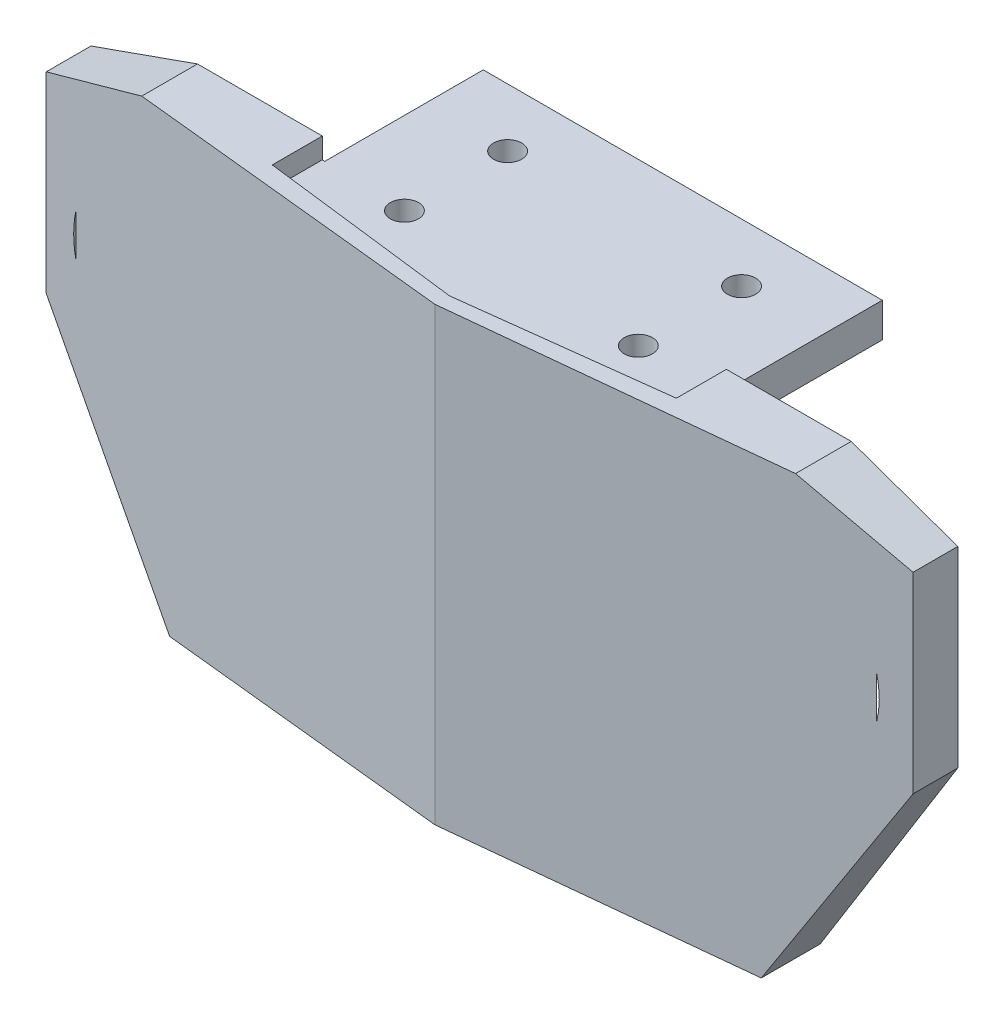
from build123d import *

# Parameters (mm, degrees)
SKETCH1_W                = 200
SKETCH1_H                = 60
BOSS_EXTRUDE1_DEPTH      = 25
SKETCH3_R                = 13.55
CUT_EXTRUDE1_DEPTH       = 7
CUT_EXTRUDE3_DEPTH       = 108.354552768
CUT_EXTRUDE7_DEPTH       = 45
FILLET8_R                = 5
SKETCH13_W               = 227.671202294
SKETCH13_H               = 68.392794906
SKETCH13_W_2             = 126
SKETCH13_H_2             = 41.42
CUT_EXTRUDE8_DEPTH       = 108.354552768
SKETCH14_W               = 12
SKETCH14_H               = 41.42
CUT_EXTRUDE9_DEPTH       = 131.573720174
CUT_EXTRUDE10_DEPTH      = 77.508930198
SKETCH19_W               = 126
SKETCH19_H               = 24.105748896
BOSS_EXTRUDE2_DEPTH      = 13
CUT_EXTRUDE11_DEPTH      = 77.508930198
CUT_EXTRUDE12_DEPTH      = 13
SKETCH22_W               = 58
SKETCH22_H               = 23.025801555
BOSS_EXTRUDE3_DEPTH      = 8
SKETCH24_W               = 40
SKETCH24_H               = 49.525748896
CUT_EXTRUDE13_DEPTH      = 4
CUT_EXTRUDE14_DEPTH      = 94.769991499
CUT_EXTRUDE14_DEPTH_BACK = 3
CUT_EXTRUDE15_DEPTH      = 94.769991499
CUT_EXTRUDE15_DEPTH_BACK = 3
SKETCH27_R               = 2.05
CUT_EXTRUDE16_DEPTH      = 92.69872852


with BuildPart() as part:
    # Sketch1 → Boss-Extrude1 (new body)
    with BuildSketch(Plane.XY):
        Rectangle(SKETCH1_W, SKETCH1_H)
    extrude(amount=BOSS_EXTRUDE1_DEPTH)

    # Sketch3 → Cut-Extrude1 (cut)
    with BuildSketch(Plane(origin=(0, 0, 0), x_dir=(-1, 0, 0), z_dir=(0, 0, -1))):
        with Locations((-45, 0)):
            Circle(SKETCH3_R)
        with Locations((45, 0)):
            Circle(SKETCH3_R)
    extrude(amount=-CUT_EXTRUDE1_DEPTH, mode=Mode.SUBTRACT)

    # Sketch6 → Cut-Extrude3 (cut, through all)
    with BuildSketch(Plane(origin=(0, 0, 0), x_dir=(-1, 0, 0), z_dir=(0, 0, -1))):
        Polygon((-87.020750536, 30), (-100, 15.531551678), (-100, 30), align=None)
        Polygon((-100, -15.090940283), (-89.003501814, -30), (-100, -30), align=None)
        Polygon((100, -15.090940283), (89.003501814, -30), (100, -30), align=None)
        Polygon((87.020750536, 30), (100, 15.531551678), (100, 30), align=None)
    extrude(amount=-CUT_EXTRUDE3_DEPTH, mode=Mode.SUBTRACT)

    # Sketch11 → Cut-Extrude7 (cut)
    with BuildSketch(Plane(origin=(0, 0, 0), x_dir=(-1, 0, 0), z_dir=(0, 0, -1))):
        Polygon((8.001444911, 30), (-99.028209758, 30), (-99.028209758, 24.58), (8.001444911, 24.58), (98.384596387, 24.58), (98.384596387, 30), align=None)
    extrude(amount=-CUT_EXTRUDE7_DEPTH, mode=Mode.SUBTRACT)

    # Fillet8
    fillet8_edges = [part.edges().sort_by_distance(p)[0] for p in [
        (100, 0.220305698, 25),
        (94.501750907, -22.545470141, 25),
        (0, -30, 25),
        (-94.501750907, -22.545470141, 25),
        (-100, 0.220305698, 25),
        (95.941442184, 20.055775839, 25),
        (-95.941442184, 20.055775839, 25),
        (0, 24.58, 25),
    ]]
    fillet(fillet8_edges, radius=FILLET8_R)

    # Sketch13 → Cut-Extrude8 (cut, through all)
    with BuildSketch(Plane(origin=(0, 0, 0), x_dir=(-1, 0, 0), z_dir=(0, 0, -1))):
        with Locations((1.665204381, -2.689234518)):
            Rectangle(SKETCH13_W, SKETCH13_H)
        with Locations((0, 2.71)):
            Rectangle(SKETCH13_W_2, SKETCH13_H_2, mode=Mode.SUBTRACT)
    extrude(amount=-CUT_EXTRUDE8_DEPTH, mode=Mode.SUBTRACT)

    # Sketch14 → Cut-Extrude9 (cut, through all)
    with BuildSketch(Plane(origin=(63, 0, 0), x_dir=(0, 0, -1), z_dir=(1, 0, 0))):
        with Locations((-19, 2.71)):
            Rectangle(SKETCH14_W, SKETCH14_H)
    extrude(amount=-CUT_EXTRUDE9_DEPTH, mode=Mode.SUBTRACT)

    # Sketch15 → Cut-Extrude10 (cut, through all)
    with BuildSketch(Plane(origin=(0, 23.42, 0), x_dir=(1, 0, 0), z_dir=(0, 1, 0))):
        Polygon((63, -6.5), (0, -13), (63, -13), align=None)
        Polygon((0, -13), (-63, -6.5), (-63, -13), align=None)
    extrude(amount=-CUT_EXTRUDE10_DEPTH, mode=Mode.SUBTRACT)

    # Sketch19 → Boss-Extrude2 (add)
    with BuildSketch(Plane(origin=(0, 0, 0), x_dir=(-1, 0, 0), z_dir=(0, 0, -1))):
        with Locations((0, -30.052874448)):
            Rectangle(SKETCH19_W, SKETCH19_H)
    extrude(amount=-BOSS_EXTRUDE2_DEPTH)

    # Sketch20 → Cut-Extrude11 (cut, through all)
    with BuildSketch(Plane(origin=(0, -18, 0), x_dir=(1, 0, 0), z_dir=(0, 1, 0))):
        Polygon((0, -13), (-63, -6.5), (-63, -13), align=None)
        Polygon((63, -6.5), (0, -13), (63, -13), align=None)
    extrude(amount=-CUT_EXTRUDE11_DEPTH, mode=Mode.SUBTRACT)

    # Sketch21 → Cut-Extrude12 (cut)
    with BuildSketch(Plane(origin=(0, 0, 0), x_dir=(-1, 0, 0), z_dir=(0, 0, -1))):
        Polygon((-63, -9.957970409), (-43, -42.105748896), (-63, -42.105748896), align=None)
        Polygon((-47.515984788, 23.42), (-63, 17.935984788), (-63, 23.42), align=None)
    cut_extrude12 = extrude(amount=-CUT_EXTRUDE12_DEPTH, mode=Mode.SUBTRACT)

    # Mirror1: Cut-Extrude12 across plane
    add(cut_extrude12.mirror(Plane(origin=(0, 0, 0), x_dir=(0, 0, 1), z_dir=(1, 0, 0))), mode=Mode.SUBTRACT)

    # Sketch22 → Boss-Extrude3 (add)
    with BuildSketch(Plane(origin=(0, 23.42, 0), x_dir=(1, 0, 0), z_dir=(0, 1, 0))):
        with Locations((0, 11.512900778)):
            Rectangle(SKETCH22_W, SKETCH22_H)
    boss_extrude3 = extrude(amount=-BOSS_EXTRUDE3_DEPTH)

    # Mirror2: Boss-Extrude3 across plane
    add(boss_extrude3.mirror(Plane(origin=(0, -9.342874448, 0), x_dir=(0, 0, 1), z_dir=(0, -1, 0))))

    # Sketch24 → Cut-Extrude13 (cut)
    with BuildSketch(Plane(origin=(0, 0, 0), x_dir=(-1, 0, 0), z_dir=(0, 0, -1))):
        with Locations((0, -9.342874448)):
            Rectangle(SKETCH24_W, SKETCH24_H)
    extrude(amount=-CUT_EXTRUDE13_DEPTH, mode=Mode.SUBTRACT)

    # Sketch25 → Cut-Extrude14 (cut, two sides: drawn at the far end of the back side and taken through both)
    with BuildSketch(Plane(origin=(0, 23.42, 0), x_dir=(1, 0, 0), z_dir=(0, 1, 0)).offset(-CUT_EXTRUDE14_DEPTH_BACK)):
        Polygon((29, 230.630036101), (29, 23.025801555), (29, 0), (29.370193256, 0), (29.370193256, -7.27376555), (0, -10.875770383), (-29.370193256, -7.27376555), (-29.370193256, 0), (-29, 0), (-29, 23.025801555), (-29, 230.630036101), (-29, 645.838505193), (29, 645.838505193), align=None)
    extrude(amount=CUT_EXTRUDE14_DEPTH + CUT_EXTRUDE14_DEPTH_BACK, mode=Mode.SUBTRACT)

    # Sketch26 → Cut-Extrude15 (cut, two sides: drawn at the far end of the back side and taken through both)
    with BuildSketch(Plane.XZ.offset(42.105748896).offset(-CUT_EXTRUDE15_DEPTH_BACK)):
        Polygon((29, -230.630036101), (29, -23.025801555), (29, 0), (29.37, 0), (29.37, 7.84856116), (0, 10.878799255), (-29.37, 7.84856116), (-29.37, 0), (-29, 0), (-29, -23.025801555), (-29, -230.630036101), (-29, -645.838505193), (29, -645.838505193), align=None)
    extrude(amount=CUT_EXTRUDE15_DEPTH + CUT_EXTRUDE15_DEPTH_BACK, mode=Mode.SUBTRACT)

    # Sketch27 → Cut-Extrude16 (cut, through all)
    with BuildSketch(Plane(origin=(0, 20.42, 0), x_dir=(1, 0, 0), z_dir=(0, 1, 0))):
        with Locations((17, -0.433798275)):
            Circle(SKETCH27_R)
        with Locations((-17, -0.433798275)):
            Circle(SKETCH27_R)
        with Locations((-17, 14.566201725)):
            Circle(SKETCH27_R)
        with Locations((17, 14.566201725)):
            Circle(SKETCH27_R)
    extrude(amount=-CUT_EXTRUDE16_DEPTH, mode=Mode.SUBTRACT)


solid = part.part
